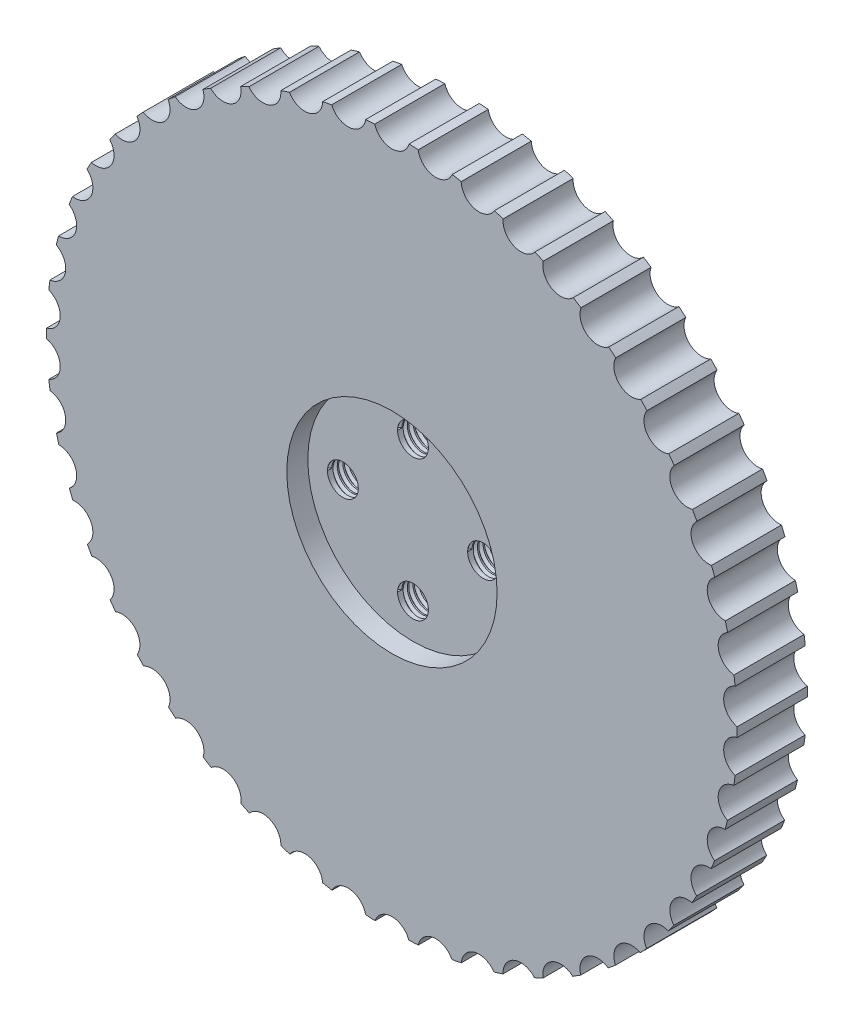
from build123d import *

# Parameters (mm, degrees)
SKIZZE1_R                       = 100
AUFSATZ_LINEAR_AUSTRAGEN1_DEPTH = 10
SKIZZE3_OUTSIDE_W               = 258.604
SKIZZE3_OUTSIDE_H               = 258.604
SKIZZE3_OUTSIDE_R               = 49.9
SCHNITT_LINEAR_AUSTRAGEN2_DEPTH = 20
SKIZZE6_R                       = 2.55
SCHNITT_LINEAR_AUSTRAGEN3_DEPTH = 20
KREISMUSTER3_COUNT              = 50
SKIZZE7_OUTSIDE_W               = 130.08
SKIZZE7_OUTSIDE_H               = 129.95
SKIZZE7_OUTSIDE_R               = 49.25
SCHNITT_LINEAR_AUSTRAGEN4_DEPTH = 20
SKIZZE8_R                       = 15
SCHNITT_LINEAR_AUSTRAGEN5_DEPTH = 3
SCHNITT_LINEAR_START            = -3
SKIZZE9_R                       = 15
SCHNITT_LINEAR_AUSTRAGEN6_DEPTH = 3
SKIZZE10_R                      = 2.2
SCHNITT_LINEAR_AUSTRAGEN7_DEPTH = 5
GEWINDE1_PITCH                  = 0.8
GEWINDE2_PITCH                  = 0.8
GEWINDE3_PITCH                  = 0.8
GEWINDE4_PITCH                  = 0.8


with BuildPart() as part:
    # Skizze1 → Aufsatz-Linear austragen1 (new body)
    with BuildSketch(Plane.XY):
        Circle(SKIZZE1_R)
    extrude(amount=AUFSATZ_LINEAR_AUSTRAGEN1_DEPTH)

    # Skizze3 outside → Schnitt-Linear austragen2 (cut)
    with BuildSketch(Plane.XY.offset(10)):
        Rectangle(SKIZZE3_OUTSIDE_W, SKIZZE3_OUTSIDE_H)
        Circle(SKIZZE3_OUTSIDE_R, mode=Mode.SUBTRACT)
    extrude(amount=-SCHNITT_LINEAR_AUSTRAGEN2_DEPTH, mode=Mode.SUBTRACT)

    # Skizze6 → Schnitt-Linear austragen3 (cut)
    with BuildSketch(Plane.XY.offset(10)):
        with Locations((0, 49.9)):
            Circle(SKIZZE6_R)
    schnitt_linear_austragen3 = extrude(amount=-SCHNITT_LINEAR_AUSTRAGEN3_DEPTH, mode=Mode.SUBTRACT)

    # Kreismuster3: Schnitt-Linear austragen3 ×50 about axis
    kreismuster3_axis = Axis((0, -0.063117385, 0), (0, 0, 1))
    for i in range(1, KREISMUSTER3_COUNT):
        add(schnitt_linear_austragen3.rotate(kreismuster3_axis, i * 360 / KREISMUSTER3_COUNT), mode=Mode.SUBTRACT)

    # Skizze7 outside → Schnitt-Linear austragen4 (cut)
    with BuildSketch(Plane.XY.offset(10)):
        Rectangle(SKIZZE7_OUTSIDE_W, SKIZZE7_OUTSIDE_H)
        Circle(SKIZZE7_OUTSIDE_R, mode=Mode.SUBTRACT)
    extrude(amount=-SCHNITT_LINEAR_AUSTRAGEN4_DEPTH, mode=Mode.SUBTRACT)

    # Skizze8 → Schnitt-Linear austragen5 (cut)
    with BuildSketch(Plane.XY.offset(10)):
        Circle(SKIZZE8_R)
    extrude(amount=-SCHNITT_LINEAR_AUSTRAGEN5_DEPTH, mode=Mode.SUBTRACT)

    # Skizze9 → Schnitt-Linear austragen6 (cut)
    with BuildSketch(Plane(origin=(0, 0, 0), x_dir=(-1, 0, 0), z_dir=(0, 0, -1)).offset(SCHNITT_LINEAR_START)):
        with Locations(Location((0, 0, 0), (0, 0, 180))):
            Circle(SKIZZE9_R)
    extrude(amount=SCHNITT_LINEAR_AUSTRAGEN6_DEPTH, mode=Mode.SUBTRACT)

    # Skizze10 → Schnitt-Linear austragen7 (cut)
    with BuildSketch(Plane.XY.offset(7)):
        with Locations((10, 0)):
            Circle(SKIZZE10_R)
        with Locations((-10, 0)):
            Circle(SKIZZE10_R)
        with Locations((0, -10)):
            Circle(SKIZZE10_R)
        with Locations((0, 10)):
            Circle(SKIZZE10_R)
    extrude(amount=-SCHNITT_LINEAR_AUSTRAGEN7_DEPTH, mode=Mode.SUBTRACT)

    # Gewinde1: the profile of Gewindeprofil1 profile screwed along a right-hand helix of 25 turns, 8 arcs to a turn; built about Z, then put on its axis
    gewinde1_z = Axis((0, 0, 0), (0, 0, 1))
    gewinde1_corners = [(2.1997, 0, -0.000173205), (2.6330127, 0, 0.249999999), (2.6330127, 0, 0.349999999), (2.1997, 0, 0.600173203)]
    with BuildLine(mode=Mode.PRIVATE) as gewinde1_profile:
        Line(gewinde1_corners[0], gewinde1_corners[1])
        Line(gewinde1_corners[1], gewinde1_corners[2])
        Line(gewinde1_corners[2], gewinde1_corners[3])
        Line(gewinde1_corners[3], gewinde1_corners[0])
    gewinde1_cap = Face(gewinde1_profile.wire())
    gewinde1_turn_angles = [0, 22.5, 45, 67.5, 90, 112.5, 135, 157.5, 180, 202.5, 225, 247.5, 270, 292.5, 315, 337.5, 360]
    gewinde1_turn_weights = [1, 0.9238795325112867, 1, 0.9238795325112867, 1, 0.9238795325112867, 1, 0.9238795325112867, 1, 0.9238795325112867, 1, 0.9238795325112867, 1, 0.9238795325112867, 1, 0.9238795325112867, 1]
    gewinde1_turn_rails = [Edge.make_bspline([Vector(p[0], p[1], 0).rotate(gewinde1_z, gewinde1_turn_angles[k]) / gewinde1_turn_weights[k] + Vector(0, 0, p[2] + GEWINDE1_PITCH * gewinde1_turn_angles[k] / 360) for k in range(17)], [0, 0, 0, 1, 1, 2, 2, 3, 3, 4, 4, 5, 5, 6, 6, 7, 7, 8, 8, 8], 2, gewinde1_turn_weights) for p in gewinde1_corners]
    gewinde1_turn_sides = [Face.make_surface_from_curves(gewinde1_turn_rails[p[0]], gewinde1_turn_rails[p[1]]) for p in [(0, 1), (1, 2), (2, 3), (3, 0)]]
    gewinde1 = Plane(origin=(0, 10, 7), x_dir=(-1, 0, 0), z_dir=(0, 0, -1)) * Solid(Shell([*[p.moved(Location((0, 0, GEWINDE1_PITCH * i))) for i in range(25) for p in gewinde1_turn_sides], gewinde1_cap, gewinde1_cap.rotate(gewinde1_z, 9000).moved(Location((0, 0, GEWINDE1_PITCH * 9000 / 360)))]))
    add(gewinde1, mode=Mode.SUBTRACT)

    # Gewinde2: the profile of Gewindeprofil2 profile screwed along a right-hand helix of 25 turns, 8 arcs to a turn; built about Z, then put on its axis
    gewinde2_z = Axis((0, 0, 0), (0, 0, 1))
    gewinde2_corners = [(2.1997, 0, -0.000173205), (2.6330127, 0, 0.249999999), (2.6330127, 0, 0.349999999), (2.1997, 0, 0.600173203)]
    with BuildLine(mode=Mode.PRIVATE) as gewinde2_profile:
        Line(gewinde2_corners[0], gewinde2_corners[1])
        Line(gewinde2_corners[1], gewinde2_corners[2])
        Line(gewinde2_corners[2], gewinde2_corners[3])
        Line(gewinde2_corners[3], gewinde2_corners[0])
    gewinde2_cap = Face(gewinde2_profile.wire())
    gewinde2_turn_angles = [0, 22.5, 45, 67.5, 90, 112.5, 135, 157.5, 180, 202.5, 225, 247.5, 270, 292.5, 315, 337.5, 360]
    gewinde2_turn_weights = [1, 0.9238795325112867, 1, 0.9238795325112867, 1, 0.9238795325112867, 1, 0.9238795325112867, 1, 0.9238795325112867, 1, 0.9238795325112867, 1, 0.9238795325112867, 1, 0.9238795325112867, 1]
    gewinde2_turn_rails = [Edge.make_bspline([Vector(p[0], p[1], 0).rotate(gewinde2_z, gewinde2_turn_angles[k]) / gewinde2_turn_weights[k] + Vector(0, 0, p[2] + GEWINDE2_PITCH * gewinde2_turn_angles[k] / 360) for k in range(17)], [0, 0, 0, 1, 1, 2, 2, 3, 3, 4, 4, 5, 5, 6, 6, 7, 7, 8, 8, 8], 2, gewinde2_turn_weights) for p in gewinde2_corners]
    gewinde2_turn_sides = [Face.make_surface_from_curves(gewinde2_turn_rails[p[0]], gewinde2_turn_rails[p[1]]) for p in [(0, 1), (1, 2), (2, 3), (3, 0)]]
    gewinde2 = Plane(origin=(-10, 0, 7), x_dir=(-1, 0, 0), z_dir=(0, 0, -1)) * Solid(Shell([*[p.moved(Location((0, 0, GEWINDE2_PITCH * i))) for i in range(25) for p in gewinde2_turn_sides], gewinde2_cap, gewinde2_cap.rotate(gewinde2_z, 9000).moved(Location((0, 0, GEWINDE2_PITCH * 9000 / 360)))]))
    add(gewinde2, mode=Mode.SUBTRACT)

    # Gewinde3: the profile of Gewindeprofil3 profile screwed along a right-hand helix of 25 turns, 8 arcs to a turn; built about Z, then put on its axis
    gewinde3_z = Axis((0, 0, 0), (0, 0, 1))
    gewinde3_corners = [(2.1997, 0, -0.000173205), (2.6330127, 0, 0.249999999), (2.6330127, 0, 0.349999999), (2.1997, 0, 0.600173203)]
    with BuildLine(mode=Mode.PRIVATE) as gewinde3_profile:
        Line(gewinde3_corners[0], gewinde3_corners[1])
        Line(gewinde3_corners[1], gewinde3_corners[2])
        Line(gewinde3_corners[2], gewinde3_corners[3])
        Line(gewinde3_corners[3], gewinde3_corners[0])
    gewinde3_cap = Face(gewinde3_profile.wire())
    gewinde3_turn_angles = [0, 22.5, 45, 67.5, 90, 112.5, 135, 157.5, 180, 202.5, 225, 247.5, 270, 292.5, 315, 337.5, 360]
    gewinde3_turn_weights = [1, 0.9238795325112867, 1, 0.9238795325112867, 1, 0.9238795325112867, 1, 0.9238795325112867, 1, 0.9238795325112867, 1, 0.9238795325112867, 1, 0.9238795325112867, 1, 0.9238795325112867, 1]
    gewinde3_turn_rails = [Edge.make_bspline([Vector(p[0], p[1], 0).rotate(gewinde3_z, gewinde3_turn_angles[k]) / gewinde3_turn_weights[k] + Vector(0, 0, p[2] + GEWINDE3_PITCH * gewinde3_turn_angles[k] / 360) for k in range(17)], [0, 0, 0, 1, 1, 2, 2, 3, 3, 4, 4, 5, 5, 6, 6, 7, 7, 8, 8, 8], 2, gewinde3_turn_weights) for p in gewinde3_corners]
    gewinde3_turn_sides = [Face.make_surface_from_curves(gewinde3_turn_rails[p[0]], gewinde3_turn_rails[p[1]]) for p in [(0, 1), (1, 2), (2, 3), (3, 0)]]
    gewinde3 = Plane(origin=(0, -10, 7), x_dir=(-1, 0, 0), z_dir=(0, 0, -1)) * Solid(Shell([*[p.moved(Location((0, 0, GEWINDE3_PITCH * i))) for i in range(25) for p in gewinde3_turn_sides], gewinde3_cap, gewinde3_cap.rotate(gewinde3_z, 9000).moved(Location((0, 0, GEWINDE3_PITCH * 9000 / 360)))]))
    add(gewinde3, mode=Mode.SUBTRACT)

    # Gewinde4: the profile of Gewindeprofil4 profile screwed along a right-hand helix of 25 turns, 8 arcs to a turn; built about Z, then put on its axis
    gewinde4_z = Axis((0, 0, 0), (0, 0, 1))
    gewinde4_corners = [(2.1997, 0, -0.000173205), (2.6330127, 0, 0.249999999), (2.6330127, 0, 0.349999999), (2.1997, 0, 0.600173203)]
    with BuildLine(mode=Mode.PRIVATE) as gewinde4_profile:
        Line(gewinde4_corners[0], gewinde4_corners[1])
        Line(gewinde4_corners[1], gewinde4_corners[2])
        Line(gewinde4_corners[2], gewinde4_corners[3])
        Line(gewinde4_corners[3], gewinde4_corners[0])
    gewinde4_cap = Face(gewinde4_profile.wire())
    gewinde4_turn_angles = [0, 22.5, 45, 67.5, 90, 112.5, 135, 157.5, 180, 202.5, 225, 247.5, 270, 292.5, 315, 337.5, 360]
    gewinde4_turn_weights = [1, 0.9238795325112867, 1, 0.9238795325112867, 1, 0.9238795325112867, 1, 0.9238795325112867, 1, 0.9238795325112867, 1, 0.9238795325112867, 1, 0.9238795325112867, 1, 0.9238795325112867, 1]
    gewinde4_turn_rails = [Edge.make_bspline([Vector(p[0], p[1], 0).rotate(gewinde4_z, gewinde4_turn_angles[k]) / gewinde4_turn_weights[k] + Vector(0, 0, p[2] + GEWINDE4_PITCH * gewinde4_turn_angles[k] / 360) for k in range(17)], [0, 0, 0, 1, 1, 2, 2, 3, 3, 4, 4, 5, 5, 6, 6, 7, 7, 8, 8, 8], 2, gewinde4_turn_weights) for p in gewinde4_corners]
    gewinde4_turn_sides = [Face.make_surface_from_curves(gewinde4_turn_rails[p[0]], gewinde4_turn_rails[p[1]]) for p in [(0, 1), (1, 2), (2, 3), (3, 0)]]
    gewinde4 = Plane(origin=(10, 0, 7), x_dir=(-1, 0, 0), z_dir=(0, 0, -1)) * Solid(Shell([*[p.moved(Location((0, 0, GEWINDE4_PITCH * i))) for i in range(25) for p in gewinde4_turn_sides], gewinde4_cap, gewinde4_cap.rotate(gewinde4_z, 9000).moved(Location((0, 0, GEWINDE4_PITCH * 9000 / 360)))]))
    add(gewinde4, mode=Mode.SUBTRACT)


solid = part.part
